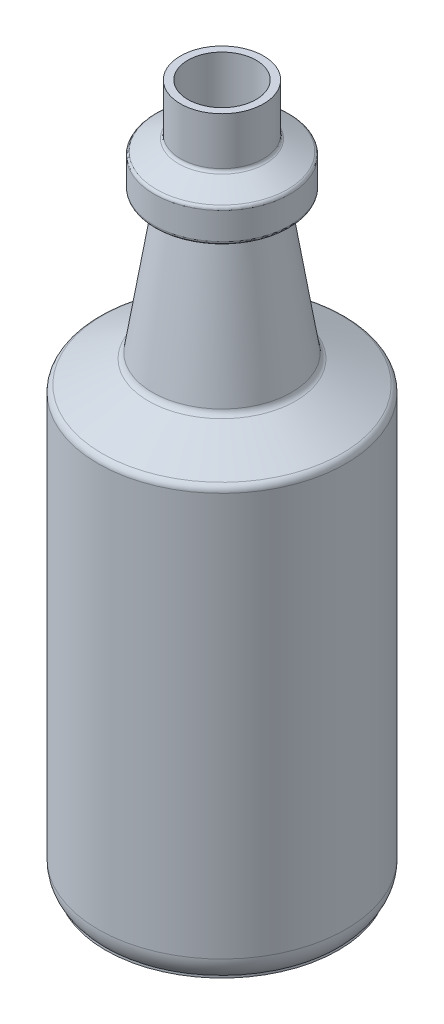
from build123d import *

# Parameters (mm, degrees)
FILLET2_R          = 1.27
FILLET3_R          = 2.54
FILLET4_R          = 10
FILLET5_R          = 2.54
FILLET6_R          = 0.635
FILLET7_R          = 1.27
F_3DSKETCH1_R      = 11.71
CUT_EXTRUDE1_DEPTH = 10


with BuildPart() as part:
    # Sketch2 → Revolve-Thin1 (revolve)
    with BuildSketch(Plane.XY):
        Polygon((0, 0), (42.4942, 0), (42.4942, 150.0124), (24.058687978, 159.004), (16.616203127, 205.994), (23.2416, 208.775020776), (23.2416, 219.665820776), (14.25, 224.2), (14.25, 241.3), (0, 241.3), (0, 238.76), (11.71, 238.76), (11.71, 222.636170224), (20.7016, 218.101991), (20.7016, 210.463541655), (13.795751305, 207.564800785), (21.756803548, 157.300695123), (39.9542, 148.425231846), (39.9542, 2.54), (0, 2.54), align=None)
    revolve(axis=Axis((0, 0, 0), (0, 1, 0)))

    # Fillet2
    fillet2_edges = [part.edges().sort_by_distance(p)[0] for p in [
        (-23.2416, 208.775020776, 0),
        (-23.2416, 219.665820776, 0),
    ]]
    fillet(fillet2_edges, radius=FILLET2_R)

    # Fillet3
    fillet3_edges = [part.edges().sort_by_distance(p)[0] for p in [
        (-42.4942, 150.0124, 0),
    ]]
    fillet(fillet3_edges, radius=FILLET3_R)

    # Fillet4
    fillet4_edges = [part.edges().sort_by_distance(p)[0] for p in [
        (-42.4942, 0, 0),
    ]]
    fillet(fillet4_edges, radius=FILLET4_R)

    # Fillet5
    fillet5_edges = [part.edges().sort_by_distance(p)[0] for p in [
        (-24.058687978, 159.004, 0),
    ]]
    fillet(fillet5_edges, radius=FILLET5_R)

    # Fillet6
    fillet6_edges = [part.edges().sort_by_distance(p)[0] for p in [
        (-16.616203127, 205.994, 0),
    ]]
    fillet(fillet6_edges, radius=FILLET6_R)

    # Fillet7
    fillet7_edges = [part.edges().sort_by_distance(p)[0] for p in [
        (-14.25, 224.2, 0),
    ]]
    fillet(fillet7_edges, radius=FILLET7_R)

    # 3DSketch1 → Cut-Extrude1 (cut)
    with BuildSketch(Plane(origin=(0, 238.76, 0), x_dir=(0, 0, -1), z_dir=(0, -1, 0))):
        Circle(F_3DSKETCH1_R)
    extrude(amount=-CUT_EXTRUDE1_DEPTH, mode=Mode.SUBTRACT)


solid = part.part
